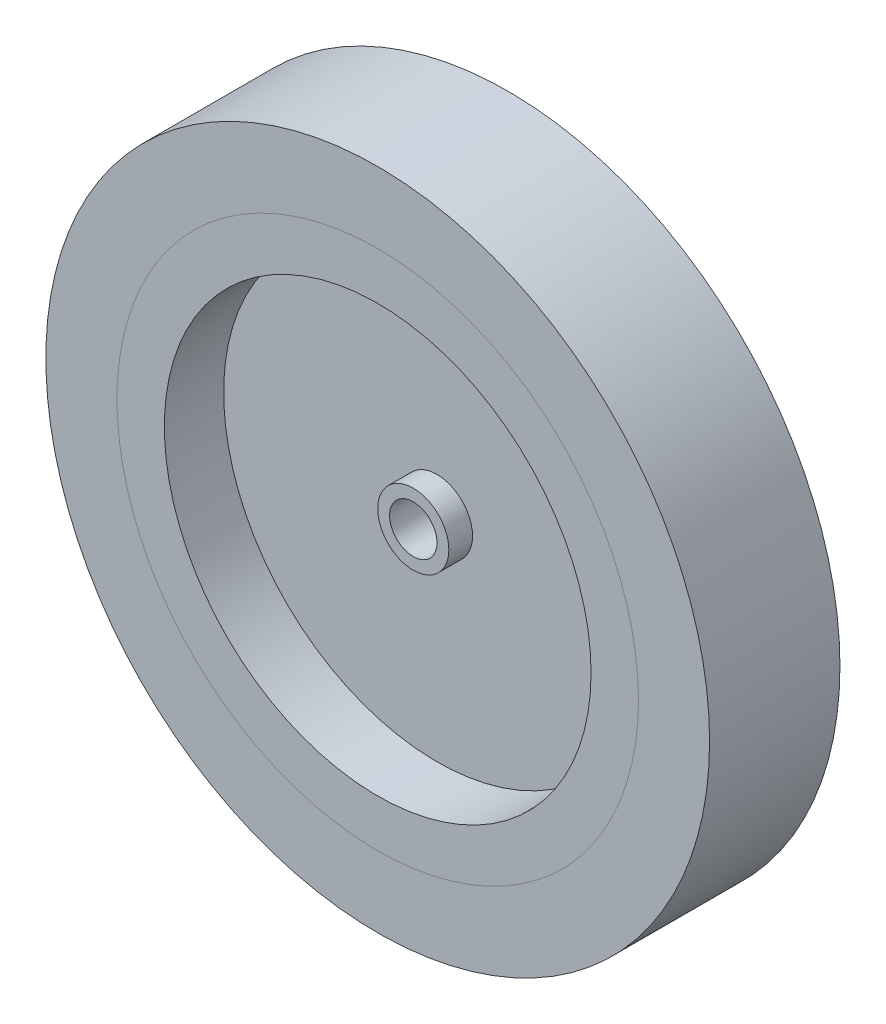
from build123d import *

# Parameters (mm, degrees)
SKETCH1_R               = 88.9
SKETCH1_R_2             = 69.85
BOSS_EXTRUDE1_DEPTH     = 17.4625
SKETCH2_R               = 69.85
BOSS_EXTRUDE2_DEPTH     = 1.5875
SKETCH3_R               = 69.85
SKETCH3_R_2             = 57.15
BOSS_EXTRUDE3_DEPTH     = 17.4625
SKETCH4_R               = 9.525
BOSS_EXTRUDE4_DEPTH     = 7.9375
BOSS_EXTRUDE5_START     = -25.4
SKETCH5_R               = 9.525
BOSS_EXTRUDE5_DEPTH     = 25.4
CUT_EXTRUDE1_DEPTH      = 129.263712717
CUT_EXTRUDE1_DEPTH_BACK = 129.263712717
SKETCH6_R               = 6.35


with BuildPart() as part:
    # Sketch1 → Boss-Extrude1 (new, symmetric)
    with BuildSketch(Plane.XY):
        Circle(SKETCH1_R)
        Circle(SKETCH1_R_2, mode=Mode.SUBTRACT)
    extrude(amount=BOSS_EXTRUDE1_DEPTH, both=True)

    # Sketch2 → Boss-Extrude2 (add, symmetric)
    with BuildSketch(Plane.XY):
        Circle(SKETCH2_R)
    extrude(amount=BOSS_EXTRUDE2_DEPTH, both=True)

    # Sketch4 → Boss-Extrude4 (add)
    with BuildSketch(Plane.XY):
        Circle(SKETCH4_R)
    extrude(amount=BOSS_EXTRUDE4_DEPTH)

    # Sketch5 → Boss-Extrude5 (add)
    with BuildSketch(Plane.XY.offset(BOSS_EXTRUDE5_START)):
        Circle(SKETCH5_R)
    extrude(amount=BOSS_EXTRUDE5_DEPTH)

    # Sketch6 → Cut-Extrude1 (cut, two sides: drawn at the far end of the back side and taken through both)
    with BuildSketch(Plane.XY.offset(-CUT_EXTRUDE1_DEPTH_BACK)):
        Circle(SKETCH6_R)
    extrude(amount=CUT_EXTRUDE1_DEPTH + CUT_EXTRUDE1_DEPTH_BACK, mode=Mode.SUBTRACT)


with BuildPart() as body_2:
    # Sketch3 → Boss-Extrude3 (new, symmetric)
    with BuildSketch(Plane.XY):
        Circle(SKETCH3_R)
        Circle(SKETCH3_R_2, mode=Mode.SUBTRACT)
    extrude(amount=BOSS_EXTRUDE3_DEPTH, both=True)


solid = Compound([part.part, body_2.part])
